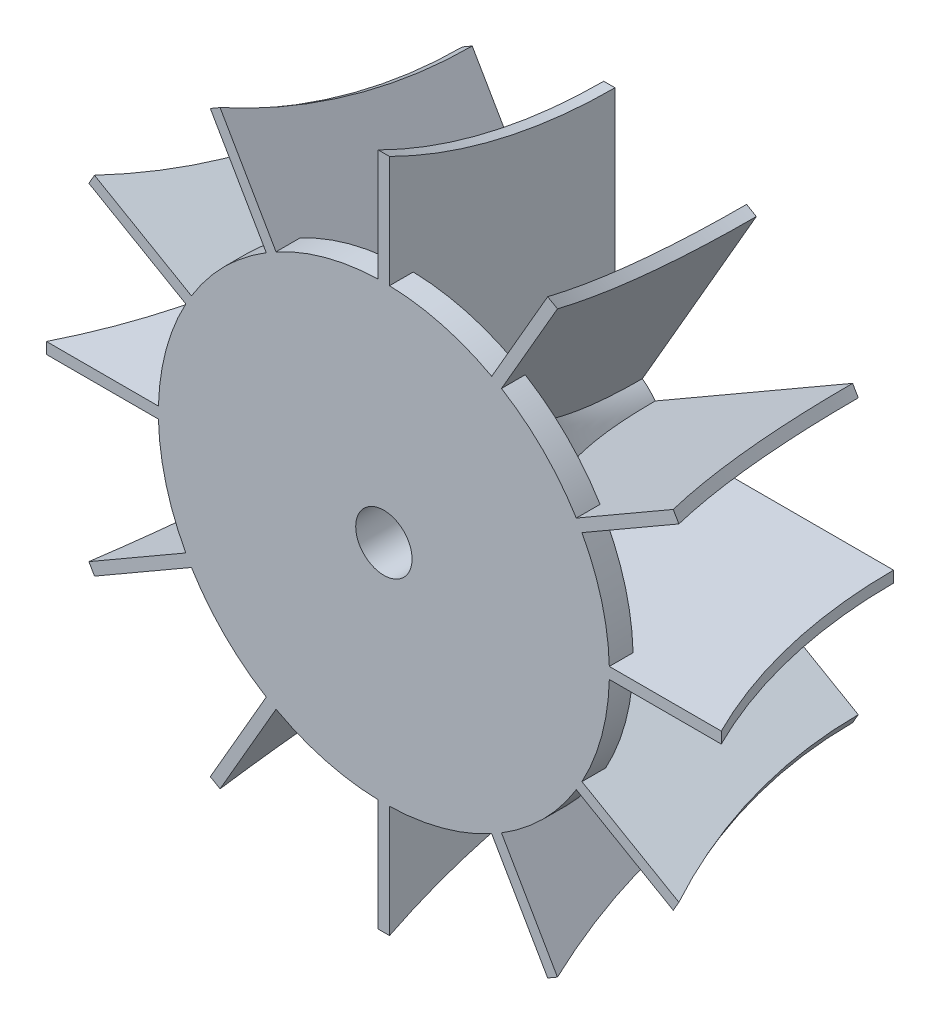
from build123d import *

# Parameters (mm, degrees)
SKETCH2_R           = 3.175
CUT_EXTRUDE1_DEPTH  = 44.994090512
BOSS_EXTRUDE1_DEPTH = 0.635
CIRPATTERN1_COUNT   = 12


with BuildPart() as part:
    # Sketch1 → Revolve1 (revolve)
    with BuildSketch(Plane(origin=(0, 0, 0), x_dir=(1, 0, 0), z_dir=(0, 1, 0))):
        with BuildLine():
            Line((0, 0), (25.4, 0))
            Line((25.4, 0), (25.4, 2.675108364))
            ThreePointArc((25.4, 2.675108364), (11.742473891, 10.573307855), (6.35, 25.4))
            Line((6.35, 25.4), (0, 25.4))
            Line((0, 25.4), (0, 0))
        make_face()
    revolve(axis=Axis((0, 0, -25.4), (0, 0, 1)))

    # Sketch2 → Cut-Extrude1 (cut, through all)
    with BuildSketch(Plane(origin=(0, 0, -25.4), x_dir=(-1, 0, 0), z_dir=(0, 0, -1))):
        Circle(SKETCH2_R)
    extrude(amount=-CUT_EXTRUDE1_DEPTH, mode=Mode.SUBTRACT)

    # Sketch4 → Boss-Extrude1 (add, symmetric)
    with BuildSketch(Plane(origin=(0, 0, 0), x_dir=(0, 0, -1), z_dir=(1, 0, 0))):
        with BuildLine():
            Line((0, -38), (0, -22.679035771))
            Line((0, -22.679035771), (6.642342031, -9.585552989))
            Line((6.642342031, -9.585552989), (25.4, -4.781973466))
            Line((25.4, -4.781973466), (25.4, -32))
            ThreePointArc((25.4, -32), (12.350478936, -33.520360829), (0, -38))
        make_face()
    boss_extrude1 = extrude(amount=BOSS_EXTRUDE1_DEPTH, both=True)

    # CirPattern1: Boss-Extrude1 ×12 about axis
    cirpattern1_axis = Axis((0, 0, -25.4), (0, 0, -1))
    for i in range(1, CIRPATTERN1_COUNT):
        add(boss_extrude1.rotate(cirpattern1_axis, i * 360 / CIRPATTERN1_COUNT))


solid = part.part
